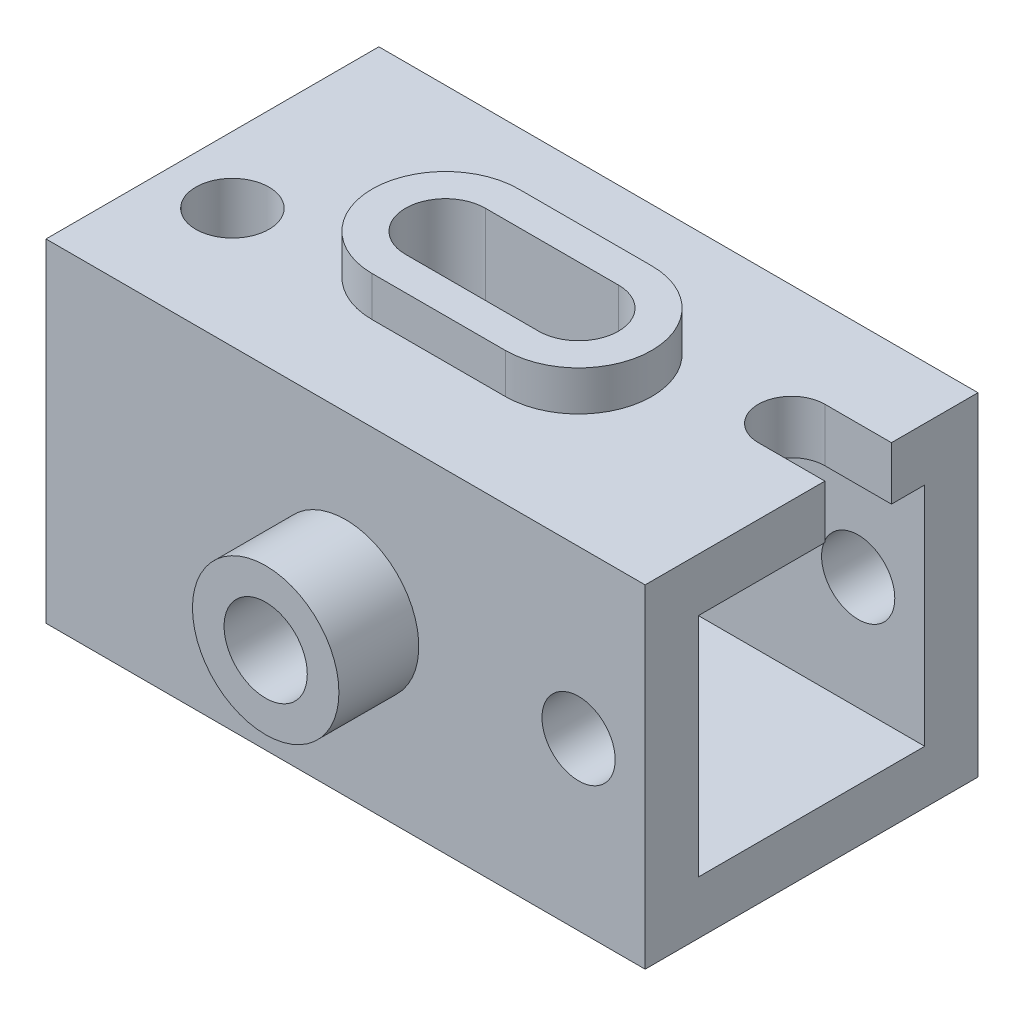
from build123d import *

# Parameters (mm, degrees)
SKETCH1_W                      = 50
SKETCH1_H                      = 50
BOSS_EXTRUDE1_DEPTH            = 45
SKETCH3_R                      = 11
BOSS_EXTRUDE2_DEPTH            = 37
BOSS_EXTRUDE3_DEPTH            = 6
SKETCH5_W                      = 34
SKETCH5_H                      = 34
CUT_EXTRUDE1_DEPTH             = 103.127371453
F_12_5_12_5_DIAMETER_HOLE1_D   = 12.5
F_12_0_START                   = 17
F_12_0_12_DIAMETER_SLOT2_DEPTH = 14
F_10_0_START                   = 17
F_10_0_10_DIAMETER_SLOT1_DEPTH = 8
M10_CLEARANCE_HOLE1_D          = 11
M10_CLEARANCE_HOLE1_DEPTH      = 8
M10_CLEARANCE_HOLE2_D          = 11
M10X1_0_TAPPED_HOLE1_D         = 9
M10X1_0_TAPPED_HOLE1_DEPTH     = 8


# Read off the part's stored shape, not the designer's step: Ø12.0 (12) Diameter Slot2, Ø10.0 (10) Diameter Slot1
with BuildPart() as part:
    # Sketch1 → Boss-Extrude1 (new, symmetric)
    with BuildSketch(Plane(origin=(0, 0, 0), x_dir=(0, 0, -1), z_dir=(1, 0, 0))):
        Rectangle(SKETCH1_W, SKETCH1_H)
    extrude(amount=BOSS_EXTRUDE1_DEPTH, both=True)

    # Sketch3 → Boss-Extrude2 (add, symmetric)
    with BuildSketch(Plane.XY):
        Circle(SKETCH3_R)
    extrude(amount=BOSS_EXTRUDE2_DEPTH, both=True)

    # Sketch4 → Boss-Extrude3 (add)
    with BuildSketch(Plane(origin=(0, 25, 0), x_dir=(1, 0, 0), z_dir=(0, 1, 0))):
        with BuildLine():
            Line((-10, 11), (10, 11))
            ThreePointArc((10, 11), (21, 0), (10, -11))
            Line((10, -11), (-10, -11))
            ThreePointArc((-10, -11), (-21, 0), (-10, 11))
        make_face()
    extrude(amount=BOSS_EXTRUDE3_DEPTH)

    # Sketch5 → Cut-Extrude1 (cut, through all)
    with BuildSketch(Plane(origin=(45, 0, 0), x_dir=(0, 0, -1), z_dir=(1, 0, 0))):
        Rectangle(SKETCH5_W, SKETCH5_H)
    extrude(amount=-CUT_EXTRUDE1_DEPTH, mode=Mode.SUBTRACT)

    # Ø12.5 (12.5) Diameter Hole1 (through all)
    with Locations(Plane.XY.offset(37)):
        with Locations((0, 0)):
            Hole(F_12_5_12_5_DIAMETER_HOLE1_D / 2)

    # Ø12.0 (12) Diameter Slot2 outline → Ø12.0 (12) Diameter Slot2 (cut)
    with BuildSketch(Plane(origin=(0, 0, 0), x_dir=(1, 0, 0), z_dir=(0, 1, 0)).offset(F_12_0_START)):
        with BuildLine():
            Line((-10, -6), (10, -6))
            ThreePointArc((10, -6), (16, 0), (10, 6))
            Line((10, 6), (-10, 6))
            ThreePointArc((-10, 6), (-16, 0), (-10, -6))
        make_face()
    extrude(amount=F_12_0_12_DIAMETER_SLOT2_DEPTH, mode=Mode.SUBTRACT)

    # Ø10.0 (10) Diameter Slot1 outline → Ø10.0 (10) Diameter Slot1 (cut)
    with BuildSketch(Plane(origin=(0, 0, 0), x_dir=(1, 0, 0), z_dir=(0, 1, 0)).offset(F_10_0_START)):
        with BuildLine():
            ThreePointArc((35, 12), (30, 7), (35, 2))
            Line((35, 2), (45, 2))
            Line((45, 2), (45, 12))
            Line((45, 12), (35, 12))
        make_face()
    extrude(amount=F_10_0_10_DIAMETER_SLOT1_DEPTH, mode=Mode.SUBTRACT)

    # M10 Clearance Hole1
    with Locations(Plane(origin=(0, 25, 0), x_dir=(1, 0, 0), z_dir=(0, 1, 0))):
        with Locations((-35, -7)):
            Hole(M10_CLEARANCE_HOLE1_D / 2, depth=M10_CLEARANCE_HOLE1_DEPTH)

    # M10 Clearance Hole2 (through all)
    with Locations(Plane(origin=(35, 0, 25), x_dir=(1, 0, 0), z_dir=(0, 0, 1))):
        with Locations((0, 0)):
            Hole(M10_CLEARANCE_HOLE2_D / 2)

    # M10x1.0 Tapped Hole1
    with Locations(Plane(origin=(0, 0, -25), x_dir=(-1, 0, 0), z_dir=(0, 0, -1))):
        with Locations((32.490263529, 0)):
            Hole(M10X1_0_TAPPED_HOLE1_D / 2, depth=M10X1_0_TAPPED_HOLE1_DEPTH)


solid = part.part
